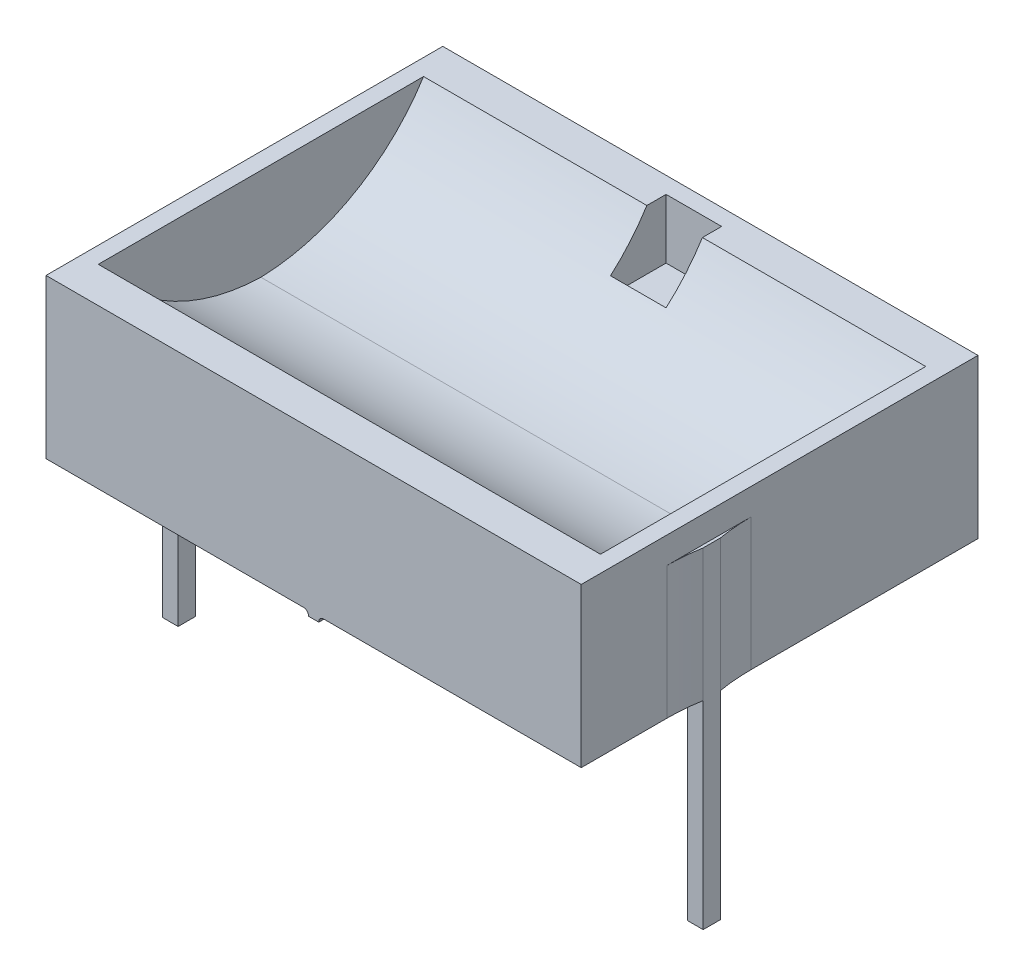
from build123d import *

# Parameters (mm, degrees)
SKETCH1_W           = 102.7938
SKETCH1_H           = 76.2
BOSS_EXTRUDE1_DEPTH = 38.1
SKETCH2_W           = 96.4438
SKETCH2_H           = 69.85
CUT_EXTRUDE1_DEPTH  = 25.4
SKETCH3_W           = 3.048
SKETCH3_H           = 3.302
BOSS_EXTRUDE2_DEPTH = 25.4
FILLET1_R           = 38.1
SKETCH8_W           = 10.668
SKETCH8_H           = 10.668
CUT_EXTRUDE3_DEPTH  = 19.05
SKETCH7_W           = 102.7938
SKETCH7_H           = 76.2
CUT_EXTRUDE4_DEPTH  = 7.62
FILLET2_R           = 38.1
SKETCH9_W           = 3.048
SKETCH9_H           = 3.302
BOSS_EXTRUDE3_DEPTH = 12.7
SKETCH10_W          = 2
SKETCH10_H          = 76.2
BOSS_EXTRUDE4_DEPTH = 1
FILLET3_R           = 0.9


with BuildPart() as part:
    # Sketch1 → Boss-Extrude1 (new body)
    with BuildSketch(Plane(origin=(0, 0, 0), x_dir=(1, 0, 0), z_dir=(0, 1, 0))):
        with Locations((51.3969, 38.1)):
            Rectangle(SKETCH1_W, SKETCH1_H)
    extrude(amount=BOSS_EXTRUDE1_DEPTH)

    # Sketch2 → Cut-Extrude1 (cut)
    with BuildSketch(Plane(origin=(0, 38.1, 0), x_dir=(1, 0, 0), z_dir=(0, 1, 0))):
        with Locations((51.3969, 38.1)):
            Rectangle(SKETCH2_W, SKETCH2_H)
    extrude(amount=-CUT_EXTRUDE1_DEPTH, mode=Mode.SUBTRACT)

    # Sketch3 → Boss-Extrude2 (add, symmetric)
    with BuildSketch(Plane.XZ):
        with Locations((0.9779, -24.524)):
            Rectangle(SKETCH3_W, SKETCH3_H)
        with Locations((101.8159, -24.524)):
            Rectangle(SKETCH3_W, SKETCH3_H)
    extrude(amount=BOSS_EXTRUDE2_DEPTH, both=True)

    # Fillet1
    # the kernel refuses this fillet: 38.1 mm, written as the material it adds along each edge
    with BuildSketch(Plane(origin=(3.175, 12.7, -3.175), x_dir=(0, 1, 0), z_dir=(1, 0, 0)), Plane(origin=(99.6188, 12.7, -73.025), x_dir=(0, 1, 0), z_dir=(-1, 0, 0))) as fillet1_piece_1:
        with BuildLine():
            CenterArc((38.1, -35.921024484), FILLET1_R, 109.471220634, 70.528779366)
            Line((0, -35.921024484), (-0.762, -35.921024484))
            Line((-0.762, -35.921024484), (-0.762, 0))
            Line((-0.762, 0), (0, 0.762))
            ThreePointArc((0, 0.762), (12.7, 0.762), (25.146, 0.71842049))
            Line((25.146, 0.71842049), (25.4, 0))
        make_face()
    extrude(amount=96.4438)

    # Sketch8 → Cut-Extrude3 (cut)
    with BuildSketch(Plane(origin=(0, 38.1, 0), x_dir=(1, 0, 0), z_dir=(0, 1, 0))):
        with Locations((51.3969, 67.691)):
            Rectangle(SKETCH8_W, SKETCH8_H)
    extrude(amount=-CUT_EXTRUDE3_DEPTH, mode=Mode.SUBTRACT)

    # Sketch7 → Cut-Extrude4 (cut)
    with BuildSketch(Plane(origin=(0, 38.1, 0), x_dir=(1, 0, 0), z_dir=(0, 1, 0))):
        with Locations((51.3969, 38.1)):
            Rectangle(SKETCH7_W, SKETCH7_H)
    extrude(amount=-CUT_EXTRUDE4_DEPTH, mode=Mode.SUBTRACT)

    # Fillet2
    # the kernel refuses this fillet: 38.1 mm, written as the material it adds along each edge
    with BuildSketch(Plane(origin=(0, 25.4, -22.873), x_dir=(0, 0, 1), z_dir=(0, -1, 0)), Plane(origin=(0, 0, -26.175), x_dir=(0, 0, -1), z_dir=(0, 1, 0))) as fillet2_piece_1:
        with BuildLine():
            CenterArc((6.42764302, 38.1), FILLET2_R, 260.287493111, 9.712506889)
            Line((0, 0.5461), (0, 0))
            Line((0, 0), (6.42764302, 0))
        make_face()
    extrude(amount=25.4)
    with BuildSketch(Plane(origin=(102.7938, 0, -26.175), x_dir=(0, 0, -1), z_dir=(0, 1, 0)), Plane(origin=(102.7938, 25.4, -22.873), x_dir=(0, 0, 1), z_dir=(0, -1, 0))) as fillet2_piece_2:
        with BuildLine():
            CenterArc((6.42764302, -38.1), FILLET2_R, 90, 9.712506889)
            Line((0, -0.5461), (0, 0))
            Line((0, 0), (6.42764302, 0))
        make_face()
    extrude(amount=25.4)

    # Sketch9 → Boss-Extrude3 (add)
    with BuildSketch(Plane.XZ.offset(25.4)):
        with Locations((0.9779, -24.524)):
            Rectangle(SKETCH9_W, SKETCH9_H)
        with Locations((101.8159, -24.524)):
            Rectangle(SKETCH9_W, SKETCH9_H)
    extrude(amount=BOSS_EXTRUDE3_DEPTH)

    # Sketch10 → Boss-Extrude4 (add)
    with BuildSketch(Plane.XZ):
        with Locations((51.3969, -38.1)):
            Rectangle(SKETCH10_W, SKETCH10_H)
    extrude(amount=BOSS_EXTRUDE4_DEPTH)

    # Fillet3
    fillet3_edges = [part.edges().sort_by_distance(p)[0] for p in [
        (50.3969, 0, -38.1),
        (52.3969, 0, -38.1),
    ]]
    fillet(fillet3_edges, radius=FILLET3_R)


solid = part.part
